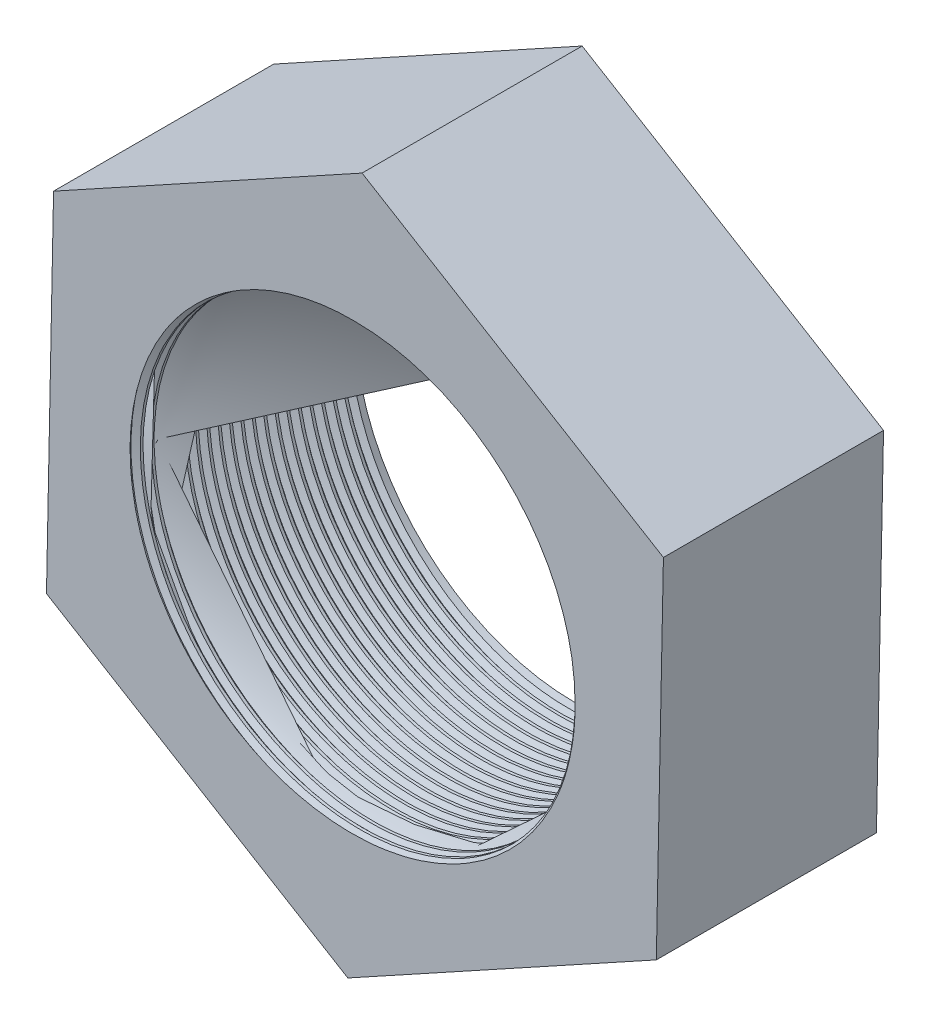
from build123d import *

# Parameters (mm, degrees)
EXTRUDE_1_DEPTH     = 5
SKETCH_2_R          = 5
CUT_EXTRUDE_1_DEPTH = 12.750681943
THREAD_1_PITCH      = 0.25


with BuildPart() as part:
    # Sketch 1 → 凸台-拉伸1 (new body)
    with BuildSketch(Plane.XY):
        Polygon((6.846123895, -4.138911404), (7.007464368, 3.859461509), (0.161340473, 7.998372913), (-6.846123895, 4.138911404), (-7.007464368, -3.859461509), (-0.161340473, -7.998372913), align=None)
    extrude(amount=EXTRUDE_1_DEPTH)

    # 草图2 → 切除-拉伸1 (cut, through all)
    with BuildSketch(Plane(origin=(0, 0, 0), x_dir=(-1, 0, 0), z_dir=(0, 0, -1))):
        Circle(SKETCH_2_R)
    extrude(amount=-CUT_EXTRUDE_1_DEPTH, mode=Mode.SUBTRACT)

    # 螺纹线1: the profile of Sketch 1 2 profile screwed along a right-hand helix of 20 turns, 6 arcs to a turn; built about Z, then put on its axis
    thread_1_z = Axis((0, 0, 0), (0, 0, 1))
    thread_1_corners = [(4.9997, 0, -0.000173205), (5.135316469, 0, 0.078125), (5.135316469, 0, 0.109375), (4.9997, 0, 0.187673204)]
    with BuildLine(mode=Mode.PRIVATE) as thread_1_profile:
        Line(thread_1_corners[0], thread_1_corners[1])
        Line(thread_1_corners[1], thread_1_corners[2])
        Line(thread_1_corners[2], thread_1_corners[3])
        Line(thread_1_corners[3], thread_1_corners[0])
    thread_1_cap = Face(thread_1_profile.wire())
    thread_1_turn_angles = [0, 30, 60, 90, 120, 150, 180, 210, 240, 270, 300, 330, 360]
    thread_1_turn_weights = [1, 0.8660254037844387, 1, 0.8660254037844387, 1, 0.8660254037844387, 1, 0.8660254037844387, 1, 0.8660254037844387, 1, 0.8660254037844387, 1]
    thread_1_turn_rails = [Edge.make_bspline([Vector(p[0], p[1], 0).rotate(thread_1_z, thread_1_turn_angles[k]) / thread_1_turn_weights[k] + Vector(0, 0, p[2] + THREAD_1_PITCH * thread_1_turn_angles[k] / 360) for k in range(13)], [0, 0, 0, 1, 1, 2, 2, 3, 3, 4, 4, 5, 5, 6, 6, 6], 2, thread_1_turn_weights) for p in thread_1_corners]
    thread_1_turn_sides = [Face.make_surface_from_curves(thread_1_turn_rails[p[0]], thread_1_turn_rails[p[1]]) for p in [(0, 1), (1, 2), (2, 3), (3, 0)]]
    thread_1 = Plane(origin=(0, 0, 0), x_dir=(1, 0, 0), z_dir=(0, 0, 1)) * Solid(Shell([*[p.moved(Location((0, 0, THREAD_1_PITCH * i))) for i in range(20) for p in thread_1_turn_sides], thread_1_cap, thread_1_cap.rotate(thread_1_z, 7200).moved(Location((0, 0, THREAD_1_PITCH * 7200 / 360)))]))
    add(thread_1, mode=Mode.SUBTRACT)


solid = part.part
